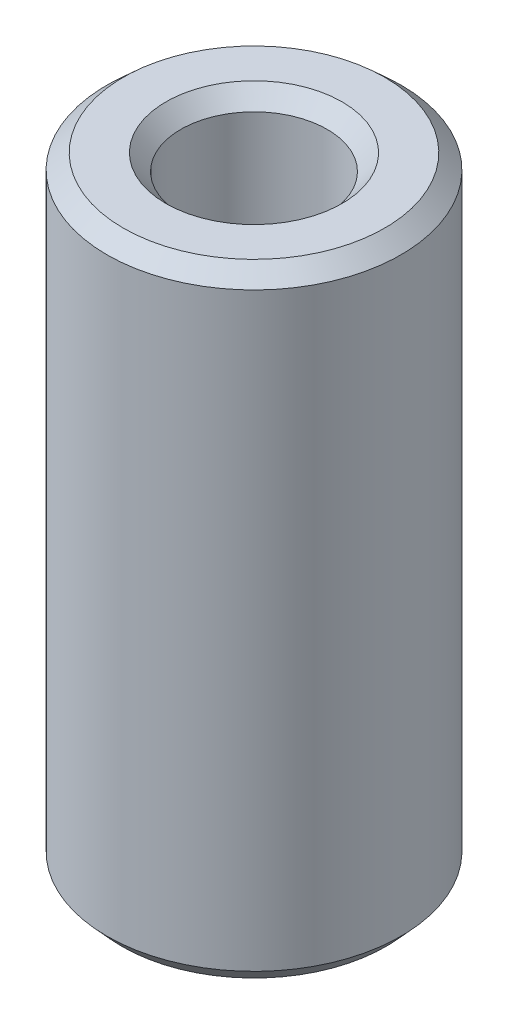
from build123d import *
from OCP.BRepFilletAPI import BRepFilletAPI_MakeChamfer

# Parameters (mm, degrees)
SKETCH1_R           = 5
BOSS_EXTRUDE1_DEPTH = 21.130508945
SKETCH2_R           = 2.488662892
CUT_EXTRUDE1_DEPTH  = 23.282244238
CHAMFER1_SIZE       = 0.50766532
CHAMFER1_SIZE2      = 0.555717584


with BuildPart() as part:
    # Sketch1 → Boss-Extrude1 (new body)
    with BuildSketch(Plane(origin=(0, 0, 0), x_dir=(1, 0, 0), z_dir=(0, 1, 0))):
        Circle(SKETCH1_R)
    extrude(amount=BOSS_EXTRUDE1_DEPTH)

    # Sketch2 → Cut-Extrude1 (cut, through all)
    with BuildSketch(Plane(origin=(0, 0, 0), x_dir=(1, 0, 0), z_dir=(0, 1, 0))):
        Circle(SKETCH2_R)
    extrude(amount=CUT_EXTRUDE1_DEPTH, mode=Mode.SUBTRACT)

    # Chamfer1: one chamfer whose edges measure the first distance from different faces: ONE call of the kernel's chamfer builder (chamfer() names one face for all edges)
    chamfer1_edges_1 = [part.edges().sort_by_distance(p)[0] for p in [
        (-2.488662892, 21.130508945, 0),
    ]]
    chamfer1_side_1 = [part.faces().sort_by_distance(p)[0] for p in [
        (-4.858578644, 21.130508945, 0),
    ]]
    chamfer1_edges_2 = [part.edges().sort_by_distance(p)[0] for p in [
        (-2.488662892, 0, 0),
    ]]
    chamfer1_side_2 = [part.faces().sort_by_distance(p)[0] for p in [
        (-2.488662892, 10.565254473, 0),
    ]]
    chamfer1_edges_3 = [part.edges().sort_by_distance(p)[0] for p in [
        (-5, 0, 0),
    ]]
    chamfer1_side_3 = [part.faces().sort_by_distance(p)[0] for p in [
        (-4.858578644, 0, 0),
    ]]
    chamfer1_edges_4 = [part.edges().sort_by_distance(p)[0] for p in [
        (-5, 21.130508945, 0),
    ]]
    chamfer1_side_4 = [part.faces().sort_by_distance(p)[0] for p in [
        (-5, 10.565254473, 0),
    ]]
    chamfer1 = BRepFilletAPI_MakeChamfer(part.part.solid().wrapped)
    for e in chamfer1_edges_1:
        chamfer1.Add(CHAMFER1_SIZE, CHAMFER1_SIZE2, e.wrapped, chamfer1_side_1[0].wrapped)  # the first distance lies on this face
    for e in chamfer1_edges_2:
        chamfer1.Add(CHAMFER1_SIZE, CHAMFER1_SIZE2, e.wrapped, chamfer1_side_2[0].wrapped)  # the first distance lies on this face
    for e in chamfer1_edges_3:
        chamfer1.Add(CHAMFER1_SIZE, CHAMFER1_SIZE2, e.wrapped, chamfer1_side_3[0].wrapped)  # the first distance lies on this face
    for e in chamfer1_edges_4:
        chamfer1.Add(CHAMFER1_SIZE, CHAMFER1_SIZE2, e.wrapped, chamfer1_side_4[0].wrapped)  # the first distance lies on this face
    add(Compound.cast(chamfer1.Shape()), mode=Mode.REPLACE)


solid = part.part
